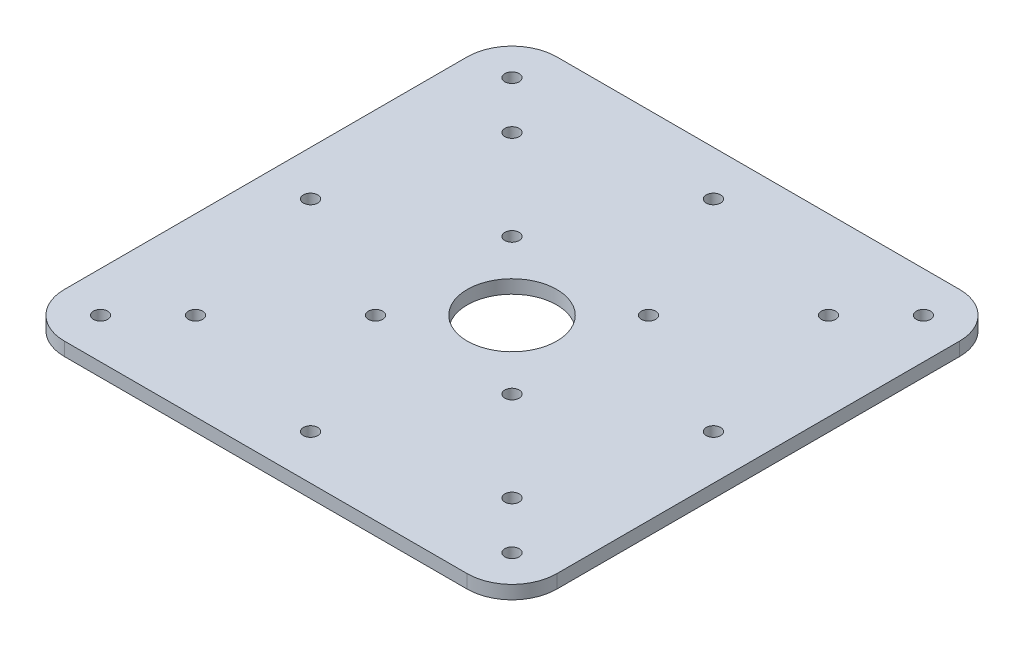
from build123d import *

# Parameters (mm, degrees)
SKETCH2_W           = 110
SKETCH2_H           = 110
SKETCH2_R           = 1.6
SKETCH2_R_2         = 10
BOSS_EXTRUDE1_DEPTH = 3
FILLET1_R           = 10


with BuildPart() as part:
    # Sketch2 → Boss-Extrude1 (new body)
    with BuildSketch(Plane(origin=(0, 0, 0), x_dir=(1, 0, 0), z_dir=(0, 1, 0))):
        Rectangle(SKETCH2_W, SKETCH2_H)
        with Locations((15.25, 15.25)):
            Circle(SKETCH2_R, mode=Mode.SUBTRACT)
        with Locations((-15.25, 15.25)):
            Circle(SKETCH2_R, mode=Mode.SUBTRACT)
        with Locations((-15.25, -15.25)):
            Circle(SKETCH2_R, mode=Mode.SUBTRACT)
        with Locations((15.25, -15.25)):
            Circle(SKETCH2_R, mode=Mode.SUBTRACT)
        with Locations((35.3553, 35.3553)):
            Circle(SKETCH2_R, mode=Mode.SUBTRACT)
        with Locations((45.9619, 45.9619)):
            Circle(SKETCH2_R, mode=Mode.SUBTRACT)
        with Locations((-35.3553, 35.3553)):
            Circle(SKETCH2_R, mode=Mode.SUBTRACT)
        with Locations((-45.9619, 45.9619)):
            Circle(SKETCH2_R, mode=Mode.SUBTRACT)
        with Locations((45.9619, -45.9619)):
            Circle(SKETCH2_R, mode=Mode.SUBTRACT)
        with Locations((35.3553, -35.3553)):
            Circle(SKETCH2_R, mode=Mode.SUBTRACT)
        with Locations((-45.9619, -45.9619)):
            Circle(SKETCH2_R, mode=Mode.SUBTRACT)
        with Locations((-35.3553, -35.3553)):
            Circle(SKETCH2_R, mode=Mode.SUBTRACT)
        with Locations((0, 45)):
            Circle(SKETCH2_R, mode=Mode.SUBTRACT)
        with Locations((0, -45)):
            Circle(SKETCH2_R, mode=Mode.SUBTRACT)
        with Locations((45, 0)):
            Circle(SKETCH2_R, mode=Mode.SUBTRACT)
        with Locations((-45, 0)):
            Circle(SKETCH2_R, mode=Mode.SUBTRACT)
        Circle(SKETCH2_R_2, mode=Mode.SUBTRACT)
    extrude(amount=BOSS_EXTRUDE1_DEPTH)

    # Fillet1
    fillet1_edges = [part.edges().sort_by_distance(p)[0] for p in [
        (55, 1.5, 55),
        (55, 1.5, -55),
        (-55, 1.5, 55),
        (-55, 1.5, -55),
    ]]
    fillet(fillet1_edges, radius=FILLET1_R)


solid = part.part
